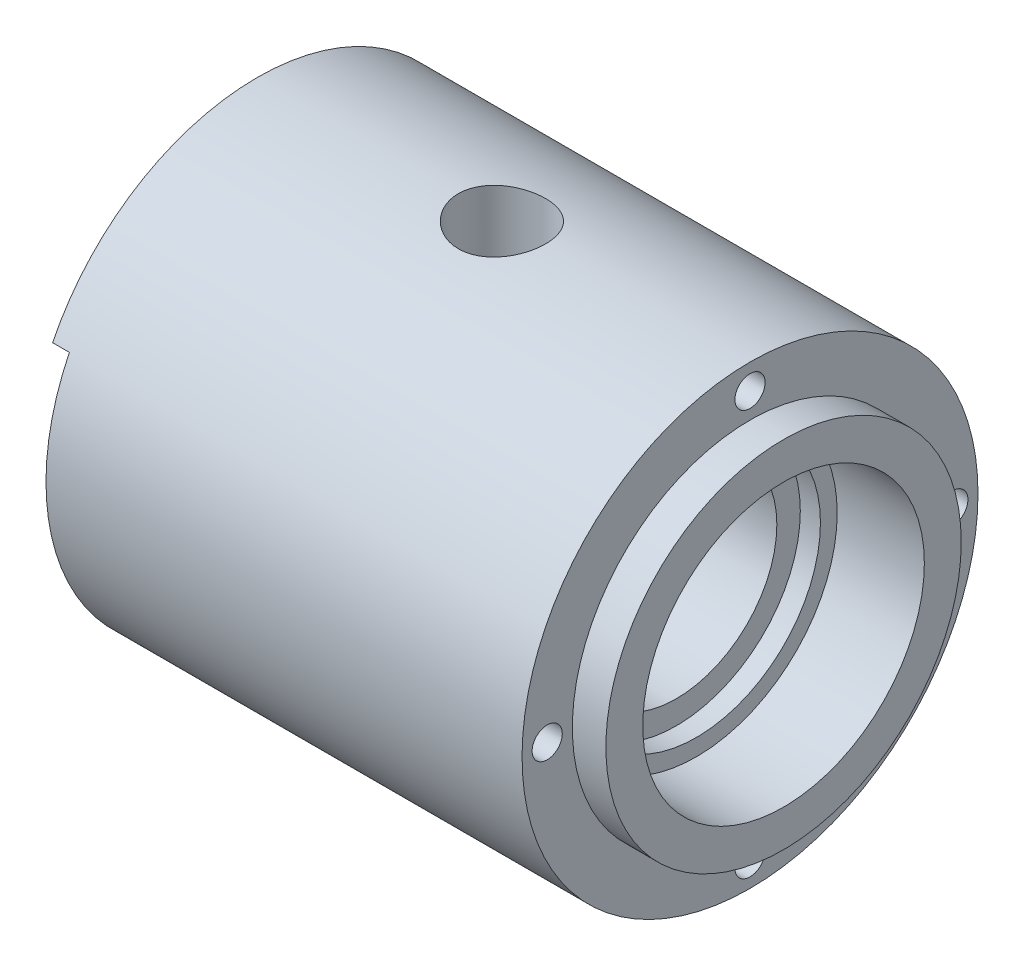
from build123d import *

# Parameters (mm, degrees)
SKETCH1_R                          = 68
BOSS_EXTRUDE1_DEPTH                = 157
CUT_EXTRUDE1_REACH                 = 186.111
SKETCH2_R                          = 26
SKETCH3_W                          = 136
SKETCH3_H                          = 98
CUT_EXTRUDE2_DEPTH                 = 5
CUT_EXTRUDE3_DEPTH                 = 44
SKETCH7_R                          = 42
CUT_EXTRUDE4_DEPTH                 = 26
SKETCH8_R                          = 37
CUT_EXTRUDE5_DEPTH                 = 6
SKETCH9_R                          = 30
CUT_EXTRUDE6_DEPTH                 = 28
CUT_EXTRUDE9_START                 = -10
SKETCH27_R                         = 68
SKETCH27_R_2                       = 53
CUT_EXTRUDE9_DEPTH                 = 10
TAP_DRILL_FOR_M1_2X0_25_TAP1_D     = 26
TAP_DRILL_FOR_M1_2X0_25_TAP1_DEPTH = 68
M8_CLEARANCE_HOLE1_D               = 9
M8_CLEARANCE_HOLE1_DEPTH           = 35
M8_CLEARANCE_HOLE1_TIP             = 2.703872786


with BuildPart() as part:
    # Sketch1 → Boss-Extrude1 (new body)
    with BuildSketch(Plane(origin=(0, 0, 0), x_dir=(0, 0, -1), z_dir=(1, 0, 0))):
        Circle(SKETCH1_R)
    extrude(amount=BOSS_EXTRUDE1_DEPTH)

    # Sketch2 → Cut-Extrude1 (cut, up to next)
    with BuildSketch(Plane.ZY, mode=Mode.PRIVATE) as cut_extrude1_sk1:
        Circle(SKETCH2_R)
    cut_extrude1_tool1 = extrude(cut_extrude1_sk1.sketch, amount=-CUT_EXTRUDE1_REACH, mode=Mode.PRIVATE) & part.part
    add(cut_extrude1_tool1.solids().sort_by_distance((0, 0, 0))[0], mode=Mode.SUBTRACT)

    # Sketch3 → Cut-Extrude2 (cut)
    with BuildSketch(Plane.ZY):
        with Locations((0, -19)):
            Rectangle(SKETCH3_W, SKETCH3_H)
    extrude(amount=-CUT_EXTRUDE2_DEPTH, mode=Mode.SUBTRACT)

    # Sketch4 → Cut-Extrude3 (cut)
    with BuildSketch(Plane.ZY.offset(-5)):
        with BuildLine():
            Line((-13.5, 29), (13.5, 29))
            ThreePointArc((13.5, 29), (0, -31.988279103), (-13.5, 29))
        make_face()
    extrude(amount=-CUT_EXTRUDE3_DEPTH, mode=Mode.SUBTRACT)

    # Sketch7 → Cut-Extrude4 (cut)
    with BuildSketch(Plane(origin=(157, 0, 0), x_dir=(0, 0, -1), z_dir=(1, 0, 0))):
        Circle(SKETCH7_R)
    extrude(amount=-CUT_EXTRUDE4_DEPTH, mode=Mode.SUBTRACT)

    # Sketch8 → Cut-Extrude5 (cut)
    with BuildSketch(Plane(origin=(131, 0, 0), x_dir=(0, 0, -1), z_dir=(1, 0, 0))):
        Circle(SKETCH8_R)
    extrude(amount=-CUT_EXTRUDE5_DEPTH, mode=Mode.SUBTRACT)

    # Sketch9 → Cut-Extrude6 (cut)
    with BuildSketch(Plane(origin=(125, 0, 0), x_dir=(0, 0, -1), z_dir=(1, 0, 0))):
        Circle(SKETCH9_R)
    extrude(amount=-CUT_EXTRUDE6_DEPTH, mode=Mode.SUBTRACT)

    # Sketch27 → Cut-Extrude9 (cut)
    with BuildSketch(Plane(origin=(157, 0, 0), x_dir=(0, 0, -1), z_dir=(1, 0, 0)).offset(CUT_EXTRUDE9_START)):
        Circle(SKETCH27_R)
        Circle(SKETCH27_R_2, mode=Mode.SUBTRACT)
    extrude(amount=CUT_EXTRUDE9_DEPTH, mode=Mode.SUBTRACT)

    # Sketch36 → Cut-Revolve2 (revolve, cut)
    with BuildSketch(Plane.XY):
        Polygon((49, 29), (60, 40), (86, 40), (97, 29), (97, 0), (49, 0), align=None)
    revolve(axis=Axis((0, 0, 0), (1, 0, 0)), mode=Mode.SUBTRACT)

    # Tap Drill for M1.2x0.25 Tap1
    with Locations(Plane(origin=(0, 68, 0), x_dir=(1, 0, 0), z_dir=(0, 1, 0))):
        with Locations((73, 0)):
            Hole(TAP_DRILL_FOR_M1_2X0_25_TAP1_D / 2, depth=TAP_DRILL_FOR_M1_2X0_25_TAP1_DEPTH)

    # M8 Clearance Hole1
    with Locations(Plane(origin=(147, 0, 0), x_dir=(0, 0, -1), z_dir=(1, 0, 0))):
        with Locations((-60.5, 0), (0, 60.5), (60.5, 0), (0, -60.5)):
            Hole(M8_CLEARANCE_HOLE1_D / 2, depth=M8_CLEARANCE_HOLE1_DEPTH)
            with Locations((0, 0, -(M8_CLEARANCE_HOLE1_DEPTH + M8_CLEARANCE_HOLE1_TIP / 2))):  # 118° drill point
                Cone(0, M8_CLEARANCE_HOLE1_D / 2, M8_CLEARANCE_HOLE1_TIP, mode=Mode.SUBTRACT)


solid = part.part
